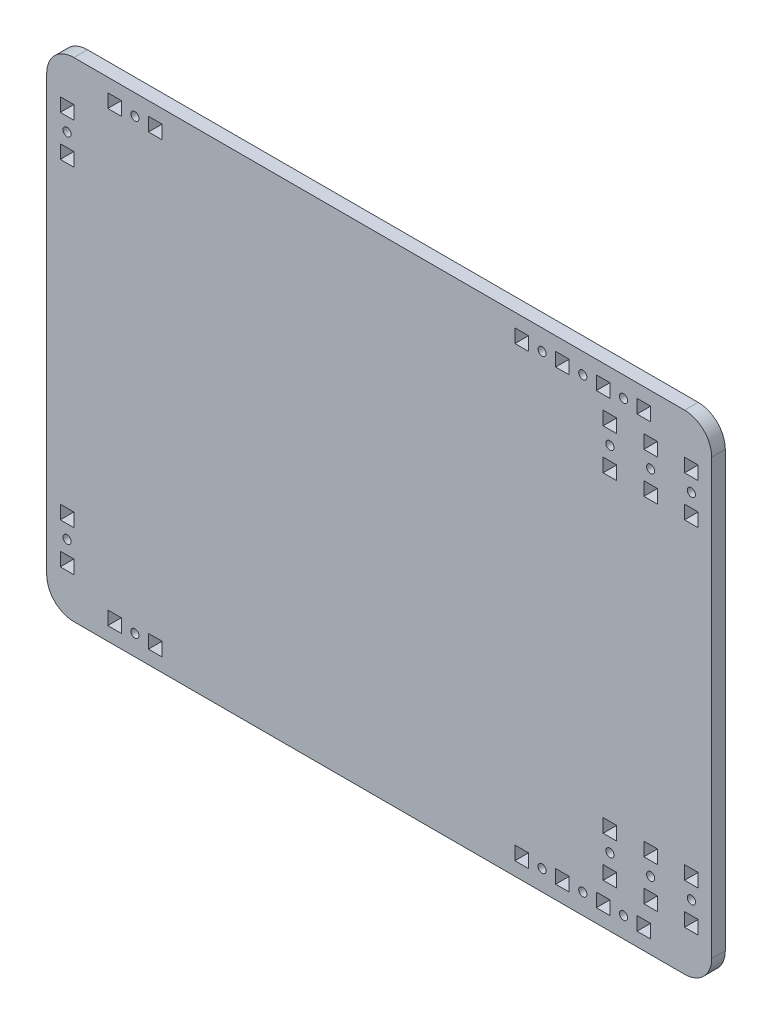
from build123d import *

# Parameters (mm, degrees)
BOSS_EXTRUDE1_OUTLINE_W   = 245.000446045
BOSS_EXTRUDE1_OUTLINE_H   = 180
BOSS_EXTRUDE1_OUTLINE_W_2 = 5
BOSS_EXTRUDE1_OUTLINE_H_2 = 5
BOSS_EXTRUDE1_OUTLINE_R   = 1.5
BOSS_EXTRUDE1_DEPTH       = 5
FILLET1_R                 = 10


# Read off the part's stored shape, not the designer's step: Boss-Extrude1
with BuildPart() as part:
    # Boss-Extrude1 outline → Boss-Extrude1 (new body)
    with BuildSketch(Plane.XY):
        with Locations((31.175821468, 0)):
            Rectangle(BOSS_EXTRUDE1_OUTLINE_W, BOSS_EXTRUDE1_OUTLINE_H)
        with Locations((-66.324847601, -82.5)):
            Rectangle(BOSS_EXTRUDE1_OUTLINE_W_2, BOSS_EXTRUDE1_OUTLINE_H_2, mode=Mode.SUBTRACT)
        with Locations((-83.824401555, -72.5)):
            Rectangle(BOSS_EXTRUDE1_OUTLINE_W_2, BOSS_EXTRUDE1_OUTLINE_H_2, mode=Mode.SUBTRACT)
        with Locations((-58.824847601, -82.5)):
            Circle(BOSS_EXTRUDE1_OUTLINE_R, mode=Mode.SUBTRACT)
        with Locations((-51.324847601, -82.5)):
            Rectangle(BOSS_EXTRUDE1_OUTLINE_W_2, BOSS_EXTRUDE1_OUTLINE_H_2, mode=Mode.SUBTRACT)
        with Locations((-83.824401555, -65)):
            Circle(BOSS_EXTRUDE1_OUTLINE_R, mode=Mode.SUBTRACT)
        with Locations((-83.824401555, -57.5)):
            Rectangle(BOSS_EXTRUDE1_OUTLINE_W_2, BOSS_EXTRUDE1_OUTLINE_H_2, mode=Mode.SUBTRACT)
        with Locations((83.67604449, -82.5)):
            Rectangle(BOSS_EXTRUDE1_OUTLINE_W_2, BOSS_EXTRUDE1_OUTLINE_H_2, mode=Mode.SUBTRACT)
        with Locations((91.17604449, -82.5)):
            Circle(BOSS_EXTRUDE1_OUTLINE_R, mode=Mode.SUBTRACT)
        with Locations((98.67604449, -82.5)):
            Rectangle(BOSS_EXTRUDE1_OUTLINE_W_2, BOSS_EXTRUDE1_OUTLINE_H_2, mode=Mode.SUBTRACT)
        with Locations((106.17604449, -82.5)):
            Circle(BOSS_EXTRUDE1_OUTLINE_R, mode=Mode.SUBTRACT)
        with Locations((113.67604449, -82.5)):
            Rectangle(BOSS_EXTRUDE1_OUTLINE_W_2, BOSS_EXTRUDE1_OUTLINE_H_2, mode=Mode.SUBTRACT)
        with Locations((121.17604449, -82.5)):
            Circle(BOSS_EXTRUDE1_OUTLINE_R, mode=Mode.SUBTRACT)
        with Locations((116.17604449, -72.5)):
            Rectangle(BOSS_EXTRUDE1_OUTLINE_W_2, BOSS_EXTRUDE1_OUTLINE_H_2, mode=Mode.SUBTRACT)
        with Locations((128.67604449, -82.5)):
            Rectangle(BOSS_EXTRUDE1_OUTLINE_W_2, BOSS_EXTRUDE1_OUTLINE_H_2, mode=Mode.SUBTRACT)
        with Locations((131.17604449, -72.5)):
            Rectangle(BOSS_EXTRUDE1_OUTLINE_W_2, BOSS_EXTRUDE1_OUTLINE_H_2, mode=Mode.SUBTRACT)
        with Locations((146.17604449, -72.5)):
            Rectangle(BOSS_EXTRUDE1_OUTLINE_W_2, BOSS_EXTRUDE1_OUTLINE_H_2, mode=Mode.SUBTRACT)
        with Locations((116.17604449, -65)):
            Circle(BOSS_EXTRUDE1_OUTLINE_R, mode=Mode.SUBTRACT)
        with Locations((116.17604449, -57.5)):
            Rectangle(BOSS_EXTRUDE1_OUTLINE_W_2, BOSS_EXTRUDE1_OUTLINE_H_2, mode=Mode.SUBTRACT)
        with Locations((131.17604449, -65)):
            Circle(BOSS_EXTRUDE1_OUTLINE_R, mode=Mode.SUBTRACT)
        with Locations((131.17604449, -57.5)):
            Rectangle(BOSS_EXTRUDE1_OUTLINE_W_2, BOSS_EXTRUDE1_OUTLINE_H_2, mode=Mode.SUBTRACT)
        with Locations((146.17604449, -65)):
            Circle(BOSS_EXTRUDE1_OUTLINE_R, mode=Mode.SUBTRACT)
        with Locations((146.17604449, -57.5)):
            Rectangle(BOSS_EXTRUDE1_OUTLINE_W_2, BOSS_EXTRUDE1_OUTLINE_H_2, mode=Mode.SUBTRACT)
        with Locations((-83.824401555, 57.5)):
            Rectangle(BOSS_EXTRUDE1_OUTLINE_W_2, BOSS_EXTRUDE1_OUTLINE_H_2, mode=Mode.SUBTRACT)
        with Locations((-83.824401555, 65)):
            Circle(BOSS_EXTRUDE1_OUTLINE_R, mode=Mode.SUBTRACT)
        with Locations((-83.824401555, 72.5)):
            Rectangle(BOSS_EXTRUDE1_OUTLINE_W_2, BOSS_EXTRUDE1_OUTLINE_H_2, mode=Mode.SUBTRACT)
        with Locations((-66.324847601, 82.5)):
            Rectangle(BOSS_EXTRUDE1_OUTLINE_W_2, BOSS_EXTRUDE1_OUTLINE_H_2, mode=Mode.SUBTRACT)
        with Locations((-58.824847601, 82.5)):
            Circle(BOSS_EXTRUDE1_OUTLINE_R, mode=Mode.SUBTRACT)
        with Locations((-51.324847601, 82.5)):
            Rectangle(BOSS_EXTRUDE1_OUTLINE_W_2, BOSS_EXTRUDE1_OUTLINE_H_2, mode=Mode.SUBTRACT)
        with Locations((83.676044481, 82.5)):
            Rectangle(BOSS_EXTRUDE1_OUTLINE_W_2, BOSS_EXTRUDE1_OUTLINE_H_2, mode=Mode.SUBTRACT)
        with Locations((91.176044481, 82.5)):
            Circle(BOSS_EXTRUDE1_OUTLINE_R, mode=Mode.SUBTRACT)
        with Locations((116.17604449, 57.5)):
            Rectangle(BOSS_EXTRUDE1_OUTLINE_W_2, BOSS_EXTRUDE1_OUTLINE_H_2, mode=Mode.SUBTRACT)
        with Locations((116.17604449, 65)):
            Circle(BOSS_EXTRUDE1_OUTLINE_R, mode=Mode.SUBTRACT)
        with Locations((131.17604449, 57.5)):
            Rectangle(BOSS_EXTRUDE1_OUTLINE_W_2, BOSS_EXTRUDE1_OUTLINE_H_2, mode=Mode.SUBTRACT)
        with Locations((131.17604449, 65)):
            Circle(BOSS_EXTRUDE1_OUTLINE_R, mode=Mode.SUBTRACT)
        with Locations((146.17604449, 57.5)):
            Rectangle(BOSS_EXTRUDE1_OUTLINE_W_2, BOSS_EXTRUDE1_OUTLINE_H_2, mode=Mode.SUBTRACT)
        with Locations((146.17604449, 65)):
            Circle(BOSS_EXTRUDE1_OUTLINE_R, mode=Mode.SUBTRACT)
        with Locations((116.17604449, 72.5)):
            Rectangle(BOSS_EXTRUDE1_OUTLINE_W_2, BOSS_EXTRUDE1_OUTLINE_H_2, mode=Mode.SUBTRACT)
        with Locations((98.67604449, 82.5)):
            Rectangle(BOSS_EXTRUDE1_OUTLINE_W_2, BOSS_EXTRUDE1_OUTLINE_H_2, mode=Mode.SUBTRACT)
        with Locations((106.17604449, 82.5)):
            Circle(BOSS_EXTRUDE1_OUTLINE_R, mode=Mode.SUBTRACT)
        with Locations((113.67604449, 82.5)):
            Rectangle(BOSS_EXTRUDE1_OUTLINE_W_2, BOSS_EXTRUDE1_OUTLINE_H_2, mode=Mode.SUBTRACT)
        with Locations((121.17604449, 82.5)):
            Circle(BOSS_EXTRUDE1_OUTLINE_R, mode=Mode.SUBTRACT)
        with Locations((131.17604449, 72.5)):
            Rectangle(BOSS_EXTRUDE1_OUTLINE_W_2, BOSS_EXTRUDE1_OUTLINE_H_2, mode=Mode.SUBTRACT)
        with Locations((146.17604449, 72.5)):
            Rectangle(BOSS_EXTRUDE1_OUTLINE_W_2, BOSS_EXTRUDE1_OUTLINE_H_2, mode=Mode.SUBTRACT)
        with Locations((128.67604449, 82.5)):
            Rectangle(BOSS_EXTRUDE1_OUTLINE_W_2, BOSS_EXTRUDE1_OUTLINE_H_2, mode=Mode.SUBTRACT)
    extrude(amount=BOSS_EXTRUDE1_DEPTH)

    # Fillet1
    fillet1_edges = [part.edges().sort_by_distance(p)[0] for p in [
        (153.67604449, -90, 2.5),
        (-91.324401555, -90, 2.5),
        (-91.324401555, 90, 2.5),
        (153.67604449, 90, 2.5),
    ]]
    fillet(fillet1_edges, radius=FILLET1_R)


solid = part.part
